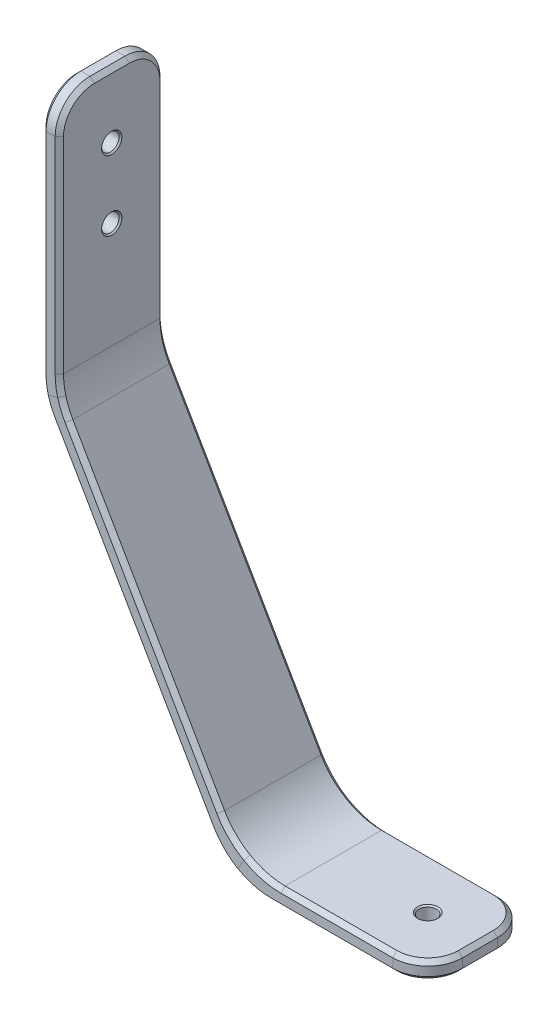
from build123d import *

# Parameters (mm, degrees)
SKETCH2_W                    = 3.175
SKETCH2_H                    = 19.05
F_1_8_0_125_DIAMETER_HOLE1_D = 3.175
F_1_8_0_125_DIAMETER_HOLE2_D = 3.175
FILLET1_R                    = 12.7
FILLET2_R                    = 6.35
CHAMFER3_SIZE                = 0.762
CHAMFER2_SIZE                = 0.254


with BuildPart() as part:
    # Sweep1: sweep along a path in Sketch1
    with BuildLine(Plane.XY) as sweep1_path:
        Line((0, 0), (0, -47.5145354))
        Line((0, -47.5145354), (33.61082832, -105.730197734))
        Line((33.61082832, -105.730197734), (68.53582832, -105.730197734))
    # Sketch2 → Sweep1 (sweep)
    with BuildSketch(Plane(origin=(0, 0, 0), x_dir=(1, 0, 0), z_dir=(0, 1, 0))):
        Rectangle(SKETCH2_W, SKETCH2_H)
    sweep(path=sweep1_path.line, transition=Transition.RIGHT)

    # 1/8 (0.125) Diameter Hole1 (through all)
    with Locations(Plane(origin=(1.5875, 0, 0), x_dir=(0, 0, -1), z_dir=(1, 0, 0))):
        with Locations((0, -11.693565329), (0, -24.393565329)):
            Hole(F_1_8_0_125_DIAMETER_HOLE1_D / 2)

    # 1/8 (0.125) Diameter Hole2 (through all)
    with Locations(Plane(origin=(0, -104.142697734, 0), x_dir=(1, 0, 0), z_dir=(0, 1, 0))):
        with Locations((59.01082832, 0)):
            Hole(F_1_8_0_125_DIAMETER_HOLE2_D / 2)

    # Fillet1
    fillet1_edges = [part.edges().sort_by_distance(p)[0] for p in [
        (-1.5875, -47.939904743, 0),
        (1.5875, -47.089166057, 0),
        (32.694284767, -107.317697734, 0),
        (34.527371872, -104.142697734, 0),
    ]]
    fillet(fillet1_edges, radius=FILLET1_R)

    # Fillet2
    fillet2_edges = [part.edges().sort_by_distance(p)[0] for p in [
        (68.53582832, -105.730197734, -9.525),
        (68.53582832, -105.730197734, 9.525),
        (0, 0, -9.525),
        (0, 0, 9.525),
    ]]
    fillet(fillet2_edges, radius=FILLET2_R)

    # Chamfer3
    chamfer3_edges = [part.edges().sort_by_distance(p)[0] for p in [
        (14.571043965, -75.927323867, -9.525),
        (-1.154757994, -47.823951872, -9.525),
        (33.676633186, -105.616220362, -9.525),
        (-1.154757994, -47.823951872, -9.525),
        (33.676633186, -105.616220362, -9.525),
        (-1.5875, -25.443475, -9.525),
        (51.106230753, -107.317697734, -9.525),
        (-1.5875, -1.859871939, -7.665128061),
        (66.67595638, -107.317697734, -7.665128061),
        (-1.5875, 0, 0),
        (68.53582832, -107.317697734, 0),
        (-1.5875, -1.859871939, 7.665128061),
        (66.67595638, -107.317697734, 7.665128061),
        (-1.5875, -25.443475, 9.525),
        (51.106230753, -107.317697734, 9.525),
        (-1.154757994, -47.823951872, 9.525),
        (33.676633186, -105.616220362, 9.525),
        (-1.154757994, -47.823951872, 9.525),
        (33.676633186, -105.616220362, 9.525),
        (14.571043965, -75.927323867, 9.525),
        (17.075087517, -73.914454524, -9.525),
        (2.020242006, -46.973213186, -9.525),
        (35.509720291, -102.441220362, -9.525),
        (2.020242006, -46.973213186, -9.525),
        (35.509720291, -102.441220362, -9.525),
        (1.5875, -25.018105657, -9.525),
        (52.022774305, -104.142697734, -9.525),
        (1.5875, -1.859871939, -7.665128061),
        (66.67595638, -104.142697734, -7.665128061),
        (1.5875, 0, 0),
        (68.53582832, -104.142697734, 0),
        (1.5875, -1.859871939, 7.665128061),
        (66.67595638, -104.142697734, 7.665128061),
        (1.5875, -25.018105657, 9.525),
        (52.022774305, -104.142697734, 9.525),
        (2.020242006, -46.973213186, 9.525),
        (35.509720291, -102.441220362, 9.525),
        (2.020242006, -46.973213186, 9.525),
        (35.509720291, -102.441220362, 9.525),
        (17.075087517, -73.914454524, 9.525),
    ]]
    chamfer(chamfer3_edges, length=CHAMFER3_SIZE)

    # Chamfer2
    chamfer2_edges = [part.edges().sort_by_distance(p)[0] for p in [
        (1.5875, -24.393565329, -1.5875),
        (-1.5875, -24.393565329, -1.5875),
        (1.5875, -11.693565329, -1.5875),
        (-1.5875, -11.693565329, -1.5875),
        (60.59832832, -104.142697734, 0),
        (60.59832832, -107.317697734, 0),
    ]]
    chamfer(chamfer2_edges, length=CHAMFER2_SIZE)


solid = part.part
